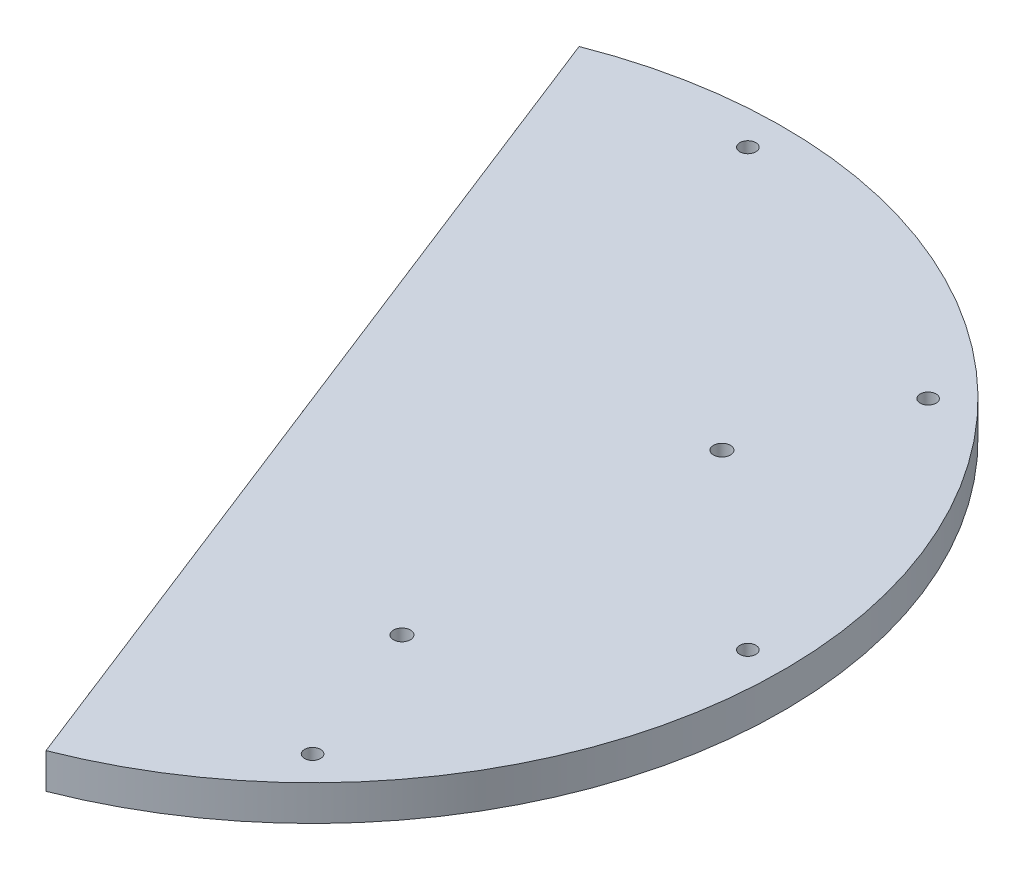
from build123d import *

# Parameters (mm, degrees)
SKETCH1_R                      = 100
BOSS_EXTRUDE1_DEPTH            = 7.5
CBORE_FOR_M3_SHCS1_D           = 3.4
CBORE_FOR_M3_SHCS1_DEPTH       = 7.5
CBORE_FOR_M3_SHCS1_CBORE_D     = 6.5
CBORE_FOR_M3_SHCS1_CBORE_DEPTH = 3
CBORE_FOR_M3_SHCS1_TIP         = 1.021463052
CBORE_FOR_M3_SHCS2_D           = 3.6
CBORE_FOR_M3_SHCS2_DEPTH       = 7.5
CBORE_FOR_M3_SHCS2_CBORE_D     = 6.5
CBORE_FOR_M3_SHCS2_CBORE_DEPTH = 3
CBORE_FOR_M3_SHCS2_TIP         = 1.081549114
SKETCH9_W                      = 276.839915284
SKETCH9_H                      = 86.454597136
CUT_EXTRUDE1_DEPTH             = 142.620090383
SKETCH11_R                     = 1.875
BOSS_EXTRUDE3_DEPTH            = 1.875
FILLET1_R                      = 1.875


with BuildPart() as part:
    # Sketch1 → Boss-Extrude1 (new body)
    with BuildSketch(Plane(origin=(0, 0, 0), x_dir=(1, 0, 0), z_dir=(0, 1, 0))):
        with Locations(Location((0, 0, 0), (0, 0, 270))):
            Circle(SKETCH1_R)
    extrude(amount=BOSS_EXTRUDE1_DEPTH)

    # CBORE for M3 SHCS1
    with Locations(Plane(origin=(0, 0, 0), x_dir=(-1, 0, 0), z_dir=(0, -1, 0))):
        with Locations((0, -92.5), (-65.40737726, -65.40737726), (-92.5, 0), (-65.40737726, 65.40737726), (0, 92.5), (65.40737726, 65.40737726), (92.5, 0), (65.40737726, -65.40737726)):
            CounterBoreHole(CBORE_FOR_M3_SHCS1_D / 2, CBORE_FOR_M3_SHCS1_CBORE_D / 2, CBORE_FOR_M3_SHCS1_CBORE_DEPTH, depth=CBORE_FOR_M3_SHCS1_DEPTH)
            with Locations((0, 0, -(CBORE_FOR_M3_SHCS1_DEPTH + CBORE_FOR_M3_SHCS1_TIP / 2))):  # 118° drill point
                Cone(0, CBORE_FOR_M3_SHCS1_D / 2, CBORE_FOR_M3_SHCS1_TIP, mode=Mode.SUBTRACT)

    # CBORE for M3 SHCS2
    with Locations(Plane(origin=(0, 0, 0), x_dir=(-1, 0, 0), z_dir=(0, -1, 0))):
        with Locations((-53, 34), (53, 34), (53, -34), (-53, -34)):
            CounterBoreHole(CBORE_FOR_M3_SHCS2_D / 2, CBORE_FOR_M3_SHCS2_CBORE_D / 2, CBORE_FOR_M3_SHCS2_CBORE_DEPTH, depth=CBORE_FOR_M3_SHCS2_DEPTH)
            with Locations((0, 0, -(CBORE_FOR_M3_SHCS2_DEPTH + CBORE_FOR_M3_SHCS2_TIP / 2))):  # 118° drill point
                Cone(0, CBORE_FOR_M3_SHCS2_D / 2, CBORE_FOR_M3_SHCS2_TIP, mode=Mode.SUBTRACT)

    # Sketch9 → Cut-Extrude1 (cut, through all)
    with BuildSketch(Plane(origin=(0, 0, 0), x_dir=(0.3646980843717534, 0, 0.9311258278318637), z_dir=(-0.9311258278318637, 0, 0.3646980843717534))):
        with Locations((-1.022117504, -7.168579764)):
            Rectangle(SKETCH9_W, SKETCH9_H)
    extrude(amount=CUT_EXTRUDE1_DEPTH, mode=Mode.SUBTRACT)

    # Sketch11 → Boss-Extrude3 (add)
    with BuildSketch(Plane(origin=(0, 0, 0), x_dir=(0.3646980843717534, 0, 0.9311258278318637), z_dir=(-0.9311258278318637, 0, 0.3646980843717534))):
        with Locations(Location((0, 3.75, 0), (0, 0, 180))):
            Circle(SKETCH11_R)
        with Locations(Location((-40, 3.75, 0), (0, 0, 180))):
            Circle(SKETCH11_R)
        with Locations(Location((-80, 3.75, 0), (0, 0, 180))):
            Circle(SKETCH11_R)
        with Locations(Location((80, 3.75, 0), (0, 0, 180))):
            Circle(SKETCH11_R)
        with Locations(Location((40, 3.75, 0), (0, 0, 180))):
            Circle(SKETCH11_R)
    extrude(amount=BOSS_EXTRUDE3_DEPTH)

    # Fillet1
    fillet1_edges = [part.edges().sort_by_distance(p)[0] for p in [
        (-1.062052019, 3.75, 2.429669835),
        (-15.649975394, 3.75, -34.815363278),
        (-30.237898769, 3.75, -72.060396391),
        (28.113794731, 3.75, 76.919736062),
        (13.525871356, 3.75, 39.674702949),
    ]]
    fillet(fillet1_edges, radius=FILLET1_R - 0.0001)  # a hair under: the kernel refuses the full size


solid = part.part
